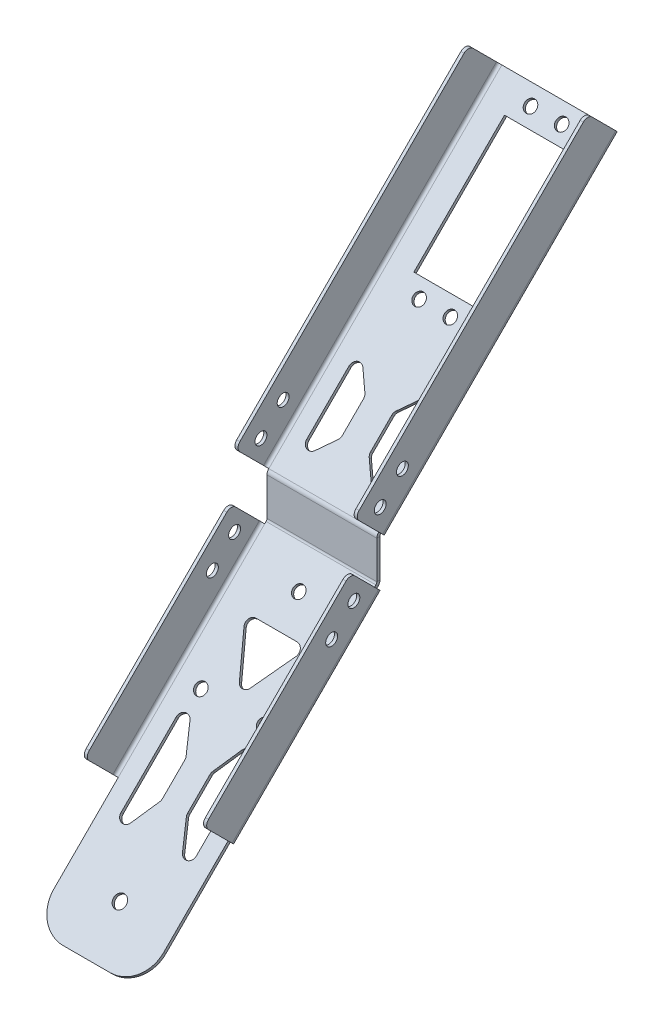
from build123d import *

# Parameters (mm, degrees)
BASE_FLANGE1_DEPTH     = 1
SKETCHED_START         = -32.5
SKETCHED_BEND5_DEPTH   = 65
SKETCHED_BEND5_2_DEPTH = 15
SKETCHED_START_2       = 17.5
SKETCHED_BEND5_3_DEPTH = 15
SKETCHED_BEND5_4_DEPTH = 65
SKETCHED_START_3       = -17.5
SKETCHED_BEND5_5_DEPTH = 35
SKETCHED_BEND6_DEPTH   = 65
SKETCHED_BEND6_2_DEPTH = 15
SKETCHED_BEND6_3_DEPTH = 15
SKETCHED_BEND6_4_DEPTH = 65
SKETCHED_BEND6_5_DEPTH = 35
SKETCHED_START_4       = -71.356310605
SKETCHED_BEND7_DEPTH   = 66
SKETCHED_BEND7_2_DEPTH = 66
SKETCHED_START_5       = 5.890889039
SKETCHED_BEND8_DEPTH   = 105
SKETCHED_BEND8_2_DEPTH = 105
F_6_CLEARANCE_HOLE2_D  = 3.7973
CUT_EXTRUDE1_REACH     = 121.977
SKETCH16_W             = 19.9
SKETCH16_H             = 40.84
CUT_EXTRUDE2_REACH     = 127.221
SKETCH31_R             = 2.025
F_6_CLEARANCE_HOLE4_D  = 3.7973
F_6_CLEARANCE_HOLE5_D  = 3.7973
FILLET1_R              = 10
FILLET2_R              = 2


# Read off the part's stored shape, not the designer's step: Sketched Bend5, Sketched Bend6, Sketched Bend7, Sketched Bend8
# Sheet-metal steps are written as plain solids
with BuildPart() as part:
    # Sketch1 → Base-Flange1 (new body)
    with BuildSketch(Plane.XY):
        Polygon((-32.5, -73.5), (-17.5, -73.5), (-17.5, -112.5), (17.5, -112.5), (17.5, -73.5), (32.5, -73.5), (32.5, -7.5), (17.5, -7.5), (17.5, 7.5), (32.5, 7.5), (32.5, 112.5), (17.5, 112.5), (-17.5, 112.5), (-32.5, 112.5), (-32.5, 7.5), (-17.5, 7.5), (-17.5, -7.5), (-32.5, -7.5), align=None)
    extrude(amount=-BASE_FLANGE1_DEPTH)

    # Sketched Bend5 outline → Sketched Bend5 (cut)
    with BuildSketch(Plane.YZ.offset(SKETCHED_START)):
        with BuildLine():
            Line((7.714213562, -0.585786438), (8.128427124, -1))
            Line((8.128427124, -1), (112.5, -1))
            Line((112.5, -1), (112.5, 0))
            Line((112.5, 0), (6.3, 0))
            ThreePointArc((6.3, 0), (7.065366865, -0.152240935), (7.714213562, -0.585786438))
        make_face()
    extrude(amount=SKETCHED_BEND5_DEPTH, mode=Mode.SUBTRACT)

    # Sketched Bend5 2 outline → Sketched Bend5 2 (cut)
    with BuildSketch(Plane.YZ.offset(SKETCHED_START)):
        with BuildLine():
            Line((7.729701149, -0.601274024), (7.714213562, -0.585786438))
            ThreePointArc((7.714213562, -0.585786438), (7.610403483, -0.48909209), (7.5, -0.4))
            Line((7.5, -0.4), (7.5, -0.830975173))
            Line((7.5, -0.830975173), (7.729701149, -0.601274024))
        make_face()
    extrude(amount=SKETCHED_BEND5_2_DEPTH, mode=Mode.SUBTRACT)

    # Sketched Bend5 3 outline → Sketched Bend5 3 (cut)
    with BuildSketch(Plane.YZ.offset(SKETCHED_START_2)):
        with BuildLine():
            Line((7.729701149, -0.601274024), (7.714213562, -0.585786438))
            ThreePointArc((7.714213562, -0.585786438), (7.610403483, -0.48909209), (7.5, -0.4))
            Line((7.5, -0.4), (7.5, -0.830975173))
            Line((7.5, -0.830975173), (7.729701149, -0.601274024))
        make_face()
    extrude(amount=SKETCHED_BEND5_3_DEPTH, mode=Mode.SUBTRACT)

    # Sketched Bend5 4 outline → Sketched Bend5 4 (add)
    with BuildSketch(Plane.YZ.offset(SKETCHED_START)):
        Polygon((81.975913173, -74.847486049), (8.128427124, -1), (7.5, -1), (7.5, -0.830975173), (7.022594368, -1.308380805), (81.268806392, -75.55459283), align=None)
    extrude(amount=SKETCHED_BEND5_4_DEPTH)

    # Sketched Bend5 5 outline → Sketched Bend5 5 (add)
    with BuildSketch(Plane.YZ.offset(SKETCHED_START_3)):
        with BuildLine():
            Line((7.022594368, -1.308380805), (7.330975173, -1))
            Line((7.330975173, -1), (6.3, -1))
            ThreePointArc((6.3, -1), (6.682683432, -1.076120467), (7.007106781, -1.292893219))
            Line((7.007106781, -1.292893219), (7.022594368, -1.308380805))
        make_face()
    extrude(amount=SKETCHED_BEND5_5_DEPTH)

    # Sketched Bend6 outline → Sketched Bend6 (cut)
    with BuildSketch(Plane.YZ.offset(SKETCHED_START)):
        with BuildLine():
            ThreePointArc((-5.710951377, -1), (-6.476318242, -0.847759065), (-7.12516494, -0.414213562))
            Line((-7.12516494, -0.414213562), (-7.539378502, 0))
            Line((-7.539378502, 0), (-112.5, 0))
            Line((-112.5, 0), (-112.5, -1))
            Line((-112.5, -1), (-5.710951377, -1))
        make_face()
    extrude(amount=SKETCHED_BEND6_DEPTH, mode=Mode.SUBTRACT)

    # Sketched Bend6 2 outline → Sketched Bend6 2 (cut)
    with BuildSketch(Plane.YZ.offset(SKETCHED_START)):
        Polygon((-7.539378502, 0), (-7.5, -0.039378502), (-7.5, 0), align=None)
    extrude(amount=SKETCHED_BEND6_2_DEPTH, mode=Mode.SUBTRACT)

    # Sketched Bend6 3 outline → Sketched Bend6 3 (cut)
    with BuildSketch(Plane.YZ.offset(SKETCHED_START_2)):
        Polygon((-7.539378502, 0), (-7.5, -0.039378502), (-7.5, 0), align=None)
    extrude(amount=SKETCHED_BEND6_3_DEPTH, mode=Mode.SUBTRACT)



with BuildPart() as body_2:
    # Sketched Bend6 4 outline → Sketched Bend6 4 (new body)
    with BuildSketch(Plane.YZ.offset(SKETCHED_START)):
        Polygon((-54.22622036, 46.686841858), (-7.557172802, 0.0177943), (-6.850066021, 0.724901081), (-53.519113579, 47.393948639), align=None)
    extrude(amount=SKETCHED_BEND6_4_DEPTH)


with BuildPart() as part_1:
    add(part.part)

    add(body_2.part)  # Sketched Bend6 5 merges body 2
    # Sketched Bend6 5 outline → Sketched Bend6 5 (add)
    with BuildSketch(Plane.YZ.offset(SKETCHED_START_3)):
        with BuildLine():
            Line((-7.557172802, 0.0177943), (-7.539378502, 0))
            Line((-7.539378502, 0), (-5.710951377, 0))
            ThreePointArc((-5.710951377, 0), (-6.09363481, 0.076120467), (-6.418058159, 0.292893219))
            Line((-6.418058159, 0.292893219), (-6.850066021, 0.724901081))
            Line((-6.850066021, 0.724901081), (-7.557172802, 0.0177943))
        make_face()
        Polygon((-81.803384826, 74.264006324), (-54.22622036, 46.686841858), (-53.519113579, 47.393948639), (-81.096278045, 74.971113105), align=None)
    extrude(amount=SKETCHED_BEND6_5_DEPTH)

    # Sketched Bend7 outline → Sketched Bend7 (cut)
    with BuildSketch(Plane(origin=(0, 0, 0), x_dir=(1, 0, 0), z_dir=(0, 0.707106781186546, -0.707106781186549)).offset(SKETCHED_START_4)):
        with BuildLine():
            ThreePointArc((-19.232050807, 4.331145665), (-18.5, 5.063196472), (-17.5, 5.331145665))
            Line((-17.5, 5.331145665), (-32.5, 5.331145665))
            Line((-32.5, 5.331145665), (-32.5, 4.331145665))
            Line((-32.5, 4.331145665), (-19.232050807, 4.331145665))
        make_face()
        with BuildLine():
            Line((32.5, 5.331145665), (17.5, 5.331145665))
            ThreePointArc((17.5, 5.331145665), (18.5, 5.063196472), (19.232050807, 4.331145665))
            Line((19.232050807, 4.331145665), (32.5, 4.331145665))
            Line((32.5, 4.331145665), (32.5, 5.331145665))
        make_face()
    extrude(amount=SKETCHED_BEND7_DEPTH, mode=Mode.SUBTRACT)

    # Sketched Bend7 2 outline → Sketched Bend7 2 (add)
    with BuildSketch(Plane(origin=(0, 0, 0), x_dir=(1, 0, 0), z_dir=(0, 0.707106781186546, -0.707106781186549)).offset(SKETCHED_START_4)):
        with BuildLine():
            Line((-17.5, 4.331145665), (-19.232050807, 4.331145665))
            ThreePointArc((-19.232050807, 4.331145665), (-19.431851652, 3.848783755), (-19.5, 3.331145665))
            Line((-19.5, 3.331145665), (-19.5, -9.312659845))
            Line((-19.5, -9.312659845), (-18.5, -9.312659845))
            Line((-18.5, -9.312659845), (-18.5, 3.331145665))
            ThreePointArc((-18.5, 3.331145665), (-18.207106781, 4.038252446), (-17.5, 4.331145665))
        make_face()
        with BuildLine():
            ThreePointArc((19.5, 3.331145665), (19.431851652, 3.848783755), (19.232050807, 4.331145665))
            Line((19.232050807, 4.331145665), (17.5, 4.331145665))
            ThreePointArc((17.5, 4.331145665), (18.207106781, 4.038252446), (18.5, 3.331145665))
            Line((18.5, 3.331145665), (18.5, -9.312659845))
            Line((18.5, -9.312659845), (19.5, -9.312659845))
            Line((19.5, -9.312659845), (19.5, 3.331145665))
        make_face()
    extrude(amount=SKETCHED_BEND7_2_DEPTH)

    # Sketched Bend8 outline → Sketched Bend8 (cut)
    with BuildSketch(Plane(origin=(0, 0, 0), x_dir=(1, 0, 0), z_dir=(0, 0.707106781186546, -0.707106781186549)).offset(SKETCHED_START_5)):
        with BuildLine():
            Line((-32.5, -5.040559159), (-19.232050807, -5.040559159))
            ThreePointArc((-19.232050807, -5.040559159), (-18.5, -4.308508352), (-17.5, -4.040559159))
            Line((-17.5, -4.040559159), (-32.5, -4.040559159))
            Line((-32.5, -4.040559159), (-32.5, -5.040559159))
        make_face()
        with BuildLine():
            Line((32.5, -4.040559159), (17.5, -4.040559159))
            ThreePointArc((17.5, -4.040559159), (18.5, -4.308508352), (19.232050807, -5.040559159))
            Line((19.232050807, -5.040559159), (32.5, -5.040559159))
            Line((32.5, -5.040559159), (32.5, -4.040559159))
        make_face()
    extrude(amount=SKETCHED_BEND8_DEPTH, mode=Mode.SUBTRACT)

    # Sketched Bend8 2 outline → Sketched Bend8 2 (add)
    with BuildSketch(Plane(origin=(0, 0, 0), x_dir=(1, 0, 0), z_dir=(0, 0.707106781186546, -0.707106781186549)).offset(SKETCHED_START_5)):
        with BuildLine():
            ThreePointArc((-19.232050807, -5.040559159), (-19.431851652, -5.522921069), (-19.5, -6.040559159))
            Line((-19.5, -6.040559159), (-19.5, -18.684364669))
            Line((-19.5, -18.684364669), (-18.5, -18.684364669))
            Line((-18.5, -18.684364669), (-18.5, -6.040559159))
            ThreePointArc((-18.5, -6.040559159), (-18.207106781, -5.333452378), (-17.5, -5.040559159))
            Line((-17.5, -5.040559159), (-19.232050807, -5.040559159))
        make_face()
        with BuildLine():
            Line((19.232050807, -5.040559159), (17.5, -5.040559159))
            ThreePointArc((17.5, -5.040559159), (18.207106781, -5.333452378), (18.5, -6.040559159))
            Line((18.5, -6.040559159), (18.5, -18.684364669))
            Line((18.5, -18.684364669), (19.5, -18.684364669))
            Line((19.5, -18.684364669), (19.5, -6.040559159))
            ThreePointArc((19.5, -6.040559159), (19.431851652, -5.522921069), (19.232050807, -5.040559159))
        make_face()
    extrude(amount=SKETCHED_BEND8_2_DEPTH)

    # #6 Clearance Hole2 (through all)
    with Locations(Plane(origin=(19.5, 0, 0), x_dir=(0, 0, -1), z_dir=(1, 0, 0))):
        with Locations((-9.311868306, -5.334166607), (-16.382936118, -12.405234419), (-0.914625389, 16.316668374), (6.156442422, 23.387736186)):
            Hole(F_6_CLEARANCE_HOLE2_D / 2)

    # Sketch16 → Cut-Extrude1 (cut, up to next)
    with BuildSketch(Plane(origin=(0, 3.564213562, 3.564213562), x_dir=(1, 0, 0), z_dir=(0, 0.7071067811865487, 0.7071067811865465)), mode=Mode.PRIVATE) as cut_extrude1_sk1:
        with BuildLine():
            Line((-12.5, 34.910953453), (-12.5, 15.870824627))
            ThreePointArc((-12.5, 15.870824627), (-11.185694979, 13.992042469), (-8.970177604, 14.582553136))
            Line((-8.970177604, 14.582553136), (-4.970177604, 19.332553136))
            ThreePointArc((-4.970177604, 19.332553136), (-4.621217842, 19.935129648), (-4.5, 20.620824627))
            Line((-4.5, 20.620824627), (-4.5, 30.160953453))
            ThreePointArc((-4.5, 30.160953453), (-4.621217842, 30.846648432), (-4.970177604, 31.449224944))
            Line((-4.970177604, 31.449224944), (-8.970177604, 36.199224944))
            ThreePointArc((-8.970177604, 36.199224944), (-11.185694979, 36.789735611), (-12.5, 34.910953453))
        make_face()
    cut_extrude1_tool1 = extrude(cut_extrude1_sk1.sketch, amount=-CUT_EXTRUDE1_REACH, mode=Mode.PRIVATE) & part_1.part
    # Sketch16 → Cut-Extrude1 (cut, up to next)
    with BuildSketch(Plane(origin=(0, 3.564213562, 3.564213562), x_dir=(1, 0, 0), z_dir=(0, 0.7071067811865487, 0.7071067811865465)), mode=Mode.PRIVATE) as cut_extrude1_sk2:
        with BuildLine():
            Line((4.5, 20.620824627), (4.5, 30.160953453))
            ThreePointArc((4.5, 30.160953453), (4.621217842, 30.846648432), (4.970177604, 31.449224944))
            Line((4.970177604, 31.449224944), (8.970177604, 36.199224944))
            ThreePointArc((8.970177604, 36.199224944), (11.185694979, 36.789735611), (12.5, 34.910953453))
            Line((12.5, 34.910953453), (12.5, 15.870824627))
            ThreePointArc((12.5, 15.870824627), (11.185694979, 13.992042469), (8.970177604, 14.582553136))
            Line((8.970177604, 14.582553136), (4.970177604, 19.332553136))
            ThreePointArc((4.970177604, 19.332553136), (4.621217842, 19.935129648), (4.5, 20.620824627))
        make_face()
    cut_extrude1_tool2 = extrude(cut_extrude1_sk2.sketch, amount=-CUT_EXTRUDE1_REACH, mode=Mode.PRIVATE) & part_1.part
    # Sketch16 → Cut-Extrude1 (cut, up to next)
    with BuildSketch(Plane(origin=(0, 3.564213562, 3.564213562), x_dir=(1, 0, 0), z_dir=(0, 0.7071067811865487, 0.7071067811865465)), mode=Mode.PRIVATE) as cut_extrude1_sk3:
        with Locations((0, 80.970889039)):
            Rectangle(SKETCH16_W, SKETCH16_H)
    cut_extrude1_tool3 = extrude(cut_extrude1_sk3.sketch, amount=-CUT_EXTRUDE1_REACH, mode=Mode.PRIVATE) & part_1.part
    add(cut_extrude1_tool1.solids().sort_by_distance((-8.925772, 21.518283, -14.389856))[0], mode=Mode.SUBTRACT)
    add(cut_extrude1_tool2.solids().sort_by_distance((8.925772, 21.518283, -14.389856))[0], mode=Mode.SUBTRACT)
    add(cut_extrude1_tool3.solids().sort_by_distance((0, 60.819278, -53.690851))[0], mode=Mode.SUBTRACT)

    # Sketch31 → Cut-Extrude2 (cut, up to next)
    with BuildSketch(Plane(origin=(0, -3.769689251, -3.769689251), x_dir=(-1, 0, 0), z_dir=(0, -0.7071067811865487, -0.7071067811865465)), mode=Mode.PRIVATE) as cut_extrude2_sk1:
        with Locations(Location((0, -95.356310605, 0), (0, 0, 90))):
            Circle(SKETCH31_R)
    cut_extrude2_tool1 = extrude(cut_extrude2_sk1.sketch, amount=-CUT_EXTRUDE2_REACH, mode=Mode.PRIVATE) & part_1.part
    # Sketch31 → Cut-Extrude2 (cut, up to next)
    with BuildSketch(Plane(origin=(0, -3.769689251, -3.769689251), x_dir=(-1, 0, 0), z_dir=(0, -0.7071067811865487, -0.7071067811865465)), mode=Mode.PRIVATE) as cut_extrude2_sk2:
        with BuildLine():
            Line((1.732050808, -39.065867303), (8.267949192, -27.745359227))
            ThreePointArc((8.267949192, -27.745359227), (8.267949192, -25.745359227), (6.535898385, -24.745359227))
            Line((6.535898385, -24.745359227), (-6.535898385, -24.745359227))
            ThreePointArc((-6.535898385, -24.745359227), (-8.267949192, -25.745359227), (-8.267949192, -27.745359227))
            Line((-8.267949192, -27.745359227), (-1.732050808, -39.065867303))
            ThreePointArc((-1.732050808, -39.065867303), (0, -40.065867303), (1.732050808, -39.065867303))
        make_face()
    cut_extrude2_tool2 = extrude(cut_extrude2_sk2.sketch, amount=-CUT_EXTRUDE2_REACH, mode=Mode.PRIVATE) & part_1.part
    # Sketch31 → Cut-Extrude2 (cut, up to next)
    with BuildSketch(Plane(origin=(0, -3.769689251, -3.769689251), x_dir=(-1, 0, 0), z_dir=(0, -0.7071067811865487, -0.7071067811865465)), mode=Mode.PRIVATE) as cut_extrude2_sk3:
        with BuildLine():
            Line((-12, -53.065867303), (-12, -77.856310605))
            ThreePointArc((-12, -77.856310605), (-10.490758652, -79.795164891), (-8.240844055, -78.807820122))
            Line((-8.240844055, -78.807820122), (-4.240844055, -71.412598471))
            ThreePointArc((-4.240844055, -71.412598471), (-4.061145713, -70.951847606), (-4, -70.461088954))
            Line((-4, -70.461088954), (-4, -60.461088954))
            ThreePointArc((-4, -60.461088954), (-4.061145713, -59.970330301), (-4.240844055, -59.509579437))
            Line((-4.240844055, -59.509579437), (-8.240844055, -52.114357786))
            ThreePointArc((-8.240844055, -52.114357786), (-10.490758652, -51.127013016), (-12, -53.065867303))
        make_face()
    cut_extrude2_tool3 = extrude(cut_extrude2_sk3.sketch, amount=-CUT_EXTRUDE2_REACH, mode=Mode.PRIVATE) & part_1.part
    # Sketch31 → Cut-Extrude2 (cut, up to next)
    with BuildSketch(Plane(origin=(0, -3.769689251, -3.769689251), x_dir=(-1, 0, 0), z_dir=(0, -0.7071067811865487, -0.7071067811865465)), mode=Mode.PRIVATE) as cut_extrude2_sk4:
        with BuildLine():
            Line((4, -70.461088954), (4, -60.461088954))
            ThreePointArc((4, -60.461088954), (4.061145713, -59.970330301), (4.240844055, -59.509579437))
            Line((4.240844055, -59.509579437), (8.240844055, -52.114357786))
            ThreePointArc((8.240844055, -52.114357786), (10.490758652, -51.127013016), (12, -53.065867303))
            Line((12, -53.065867303), (12, -77.856310605))
            ThreePointArc((12, -77.856310605), (10.490758652, -79.795164891), (8.240844055, -78.807820122))
            Line((8.240844055, -78.807820122), (4.240844055, -71.412598471))
            ThreePointArc((4.240844055, -71.412598471), (4.061145713, -70.951847606), (4, -70.461088954))
        make_face()
    cut_extrude2_tool4 = extrude(cut_extrude2_sk4.sketch, amount=-CUT_EXTRUDE2_REACH, mode=Mode.PRIVATE) & part_1.part
    add(cut_extrude2_tool1.solids().sort_by_distance((0, -71.196783, 63.657405))[0], mode=Mode.SUBTRACT)
    add(cut_extrude2_tool2.solids().sort_by_distance((0, -25.349783, 17.810405))[0], mode=Mode.SUBTRACT)
    add(cut_extrude2_tool3.solids().sort_by_distance((8.518356, -50.057669, 42.518291))[0], mode=Mode.SUBTRACT)
    add(cut_extrude2_tool4.solids().sort_by_distance((-8.518356, -50.057669, 42.518291))[0], mode=Mode.SUBTRACT)

    # #6 Clearance Hole4 (through all)
    with Locations(Plane(origin=(0, -3.769689251, -3.769689251), x_dir=(-1, 0, 0), z_dir=(0, -0.7071067811865487, -0.7071067811865465))):
        with Locations((-10, -44.745359227), (10, -44.745359227), (0, -14.745359227)):
            Hole(F_6_CLEARANCE_HOLE4_D / 2)

    # #6 Clearance Hole5 (through all)
    with Locations(Plane(origin=(0, 2.857106781, 2.857106781), x_dir=(-1, 0, 0), z_dir=(0, -0.7071067811865487, -0.7071067811865465))):
        with Locations((4.97, 106.070889039), (-4.97, 106.070889039), (4.97, 55.870889039), (-4.97, 55.870889039)):
            Hole(F_6_CLEARANCE_HOLE5_D / 2)

    # Fillet1
    fillet1_edges = [part_1.edges().sort_by_distance(p)[0] for p in [
        (-17.5, -81.449831436, 74.617559715),
        (17.5, -81.449831436, 74.617559715),
    ]]
    fillet(fillet1_edges, radius=FILLET1_R)

    # Fillet2
    fillet2_edges = [part_1.edges().sort_by_distance(p)[0] for p in [
        (-19, -43.871486182, 57.041576037),
        (-19, 2.797561376, 10.372528478),
        (19, 2.797561376, 10.372528478),
        (19, -43.871486182, 57.041576037),
        (-19, 17.377328546, 9.046353373),
        (-19, 91.623540571, -65.199858652),
        (19, 91.623540571, -65.199858652),
        (19, 17.377328546, 9.046353373),
    ]]
    fillet(fillet2_edges, radius=FILLET2_R)


solid = part_1.part
